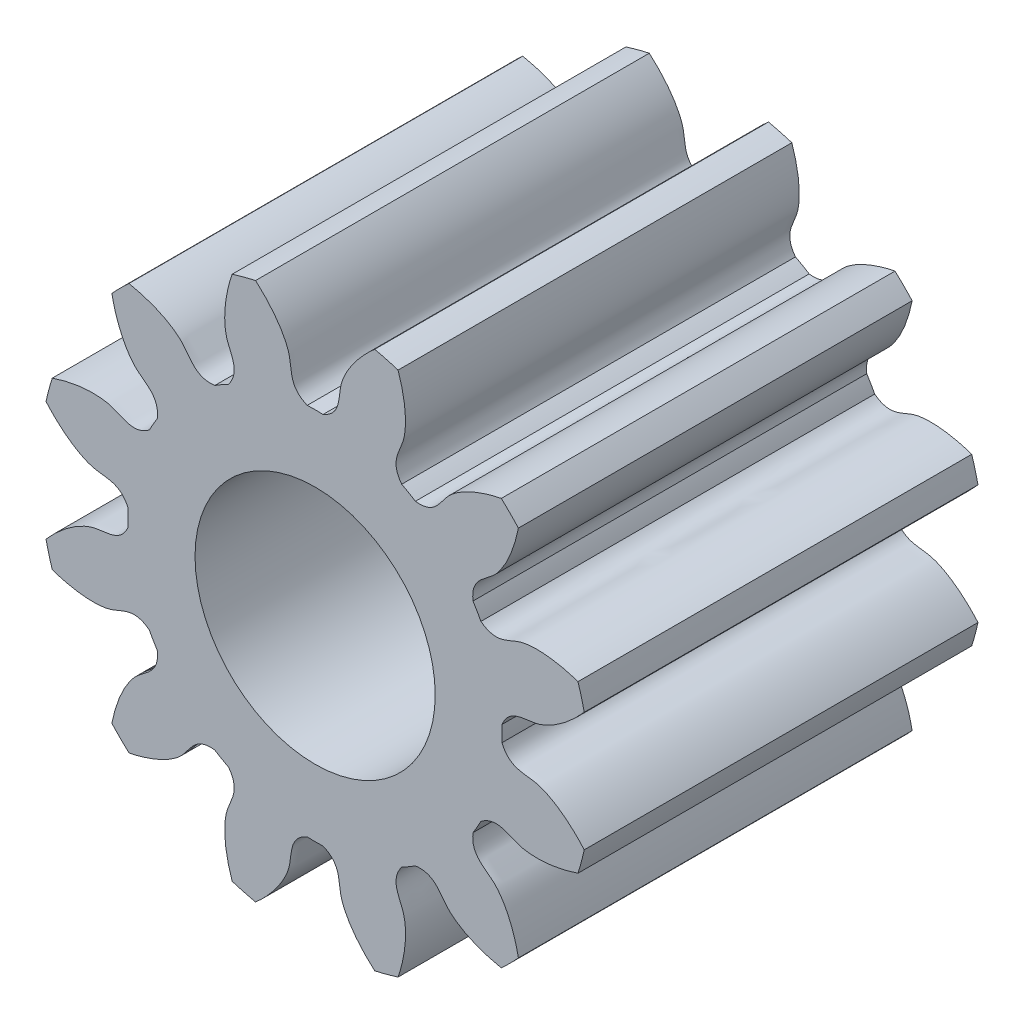
from build123d import *

# Parameters (mm, degrees)
SKETCH_1_R               = 3.5
EXTRUDE_1_DEPTH          = 5
CUT_EXTRUDE_1_DEPTH      = 8.03562364
PATTERN_CIRCULAR_1_COUNT = 12
CUT_EXTRUDE_2_REACH      = 8.954
SKETCH_4_R               = 1.525


with BuildPart() as part:
    # 草图1 → 凸台-拉伸1 (new body)
    with BuildSketch(Plane.XY):
        Circle(SKETCH_1_R)
    extrude(amount=EXTRUDE_1_DEPTH)

    # 草图2 → 切除-拉伸1 (cut, through all)
    with BuildSketch(Plane.XY):
        with BuildLine():
            ThreePointArc((0.100420056, 2.372876063), (0, 2.375), (-0.100420056, 2.372876063))
            add(Edge.make_bspline(
                [(-0.100420056, 2.372876063), (-0.340394435, 2.474653731), (-0.287186739, 2.672409341), (-0.338076094, 2.844740289), (-0.341311927, 2.854952869), (-0.345113625, 2.866166713), (-0.349521434, 2.878363044), (-0.354576313, 2.891521619), (-0.360318258, 2.905621034), (-0.36678678, 2.920638648), (-0.374020716, 2.936550626), (-0.382058239, 2.95333195), (-0.390936819, 2.970956436), (-0.400693193, 2.989396753), (-0.411363332, 3.008624444), (-0.422982412, 3.02860994), (-0.435584786, 3.049322589), (-0.449203949, 3.07073067), (-0.463872517, 3.092801417), (-0.479622192, 3.115501045), (-0.496483738, 3.138794769), (-0.514486952, 3.162646832), (-0.533660639, 3.187020528), (-0.554032585, 3.211878226), (-0.575629533, 3.237181399), (-0.598477155, 3.262890651), (-0.622600033, 3.288965742), (-0.648021632, 3.315365616), (-0.674764279, 3.342048434), (-0.702849139, 3.368971597), (-0.732296196, 3.396091781), (-0.763124233, 3.423364967), (-0.795350811, 3.450746465), (-0.828992247, 3.478190957), (-0.864063604, 3.505652518), (-0.900578664, 3.533084654), (-0.938549918, 3.560440334), (-0.977988547, 3.587672024), (-1.01890441, 3.614731718), (-1.061306025, 3.641570973), (-1.10520056, 3.668140947), (-1.150593819, 3.694392428), (-1.197490231, 3.720275872), (-1.245892835, 3.74574144), (-1.295803277, 3.770739031), (-1.347221796, 3.79521832), (-1.400147219, 3.819128792), (-1.454576948, 3.842419781), (-1.510506963, 3.865040505), (-1.567931802, 3.886940103), (-1.647189853, 3.915363979), (-1.7077968, 3.935050704), (-1.748802701, 3.947485455)],
                knots=[0, 0, 0, 0, 0.218015236, 0.222043642, 0.226545979, 0.231522246, 0.236972443, 0.24289657, 0.249294627, 0.256166614, 0.263512532, 0.271332379, 0.279626157, 0.288393865, 0.297635503, 0.307351072, 0.31754057, 0.328203999, 0.339341357, 0.350952646, 0.363037866, 0.375597015, 0.388630094, 0.402137104, 0.416118043, 0.430572913, 0.445501713, 0.460904444, 0.476781104, 0.493131694, 0.509956215, 0.527254666, 0.545027047, 0.563273358, 0.581993599, 0.601187771, 0.620855872, 0.640997904, 0.661613866, 0.682703758, 0.704267581, 0.726305333, 0.748817015, 0.771802628, 0.795262171, 0.819195644, 0.843603047, 0.868484381, 0.893839644, 0.919668838, 0.945971962, 1, 1, 1, 1], degree=3))
            ThreePointArc((-1.748802701, 3.947485455), (0, 4.317516914), (1.748802701, 3.947485455))
            add(Edge.make_bspline(
                [(0.100420056, 2.372876063), (0.340394435, 2.474653731), (0.287186739, 2.672409341), (0.338076094, 2.844740289), (0.341311927, 2.854952869), (0.345113625, 2.866166713), (0.349521434, 2.878363044), (0.354576313, 2.891521619), (0.360318258, 2.905621034), (0.36678678, 2.920638648), (0.374020716, 2.936550626), (0.382058239, 2.95333195), (0.390936819, 2.970956436), (0.400693193, 2.989396753), (0.411363332, 3.008624444), (0.422982412, 3.02860994), (0.435584786, 3.049322589), (0.449203949, 3.07073067), (0.463872517, 3.092801417), (0.479622192, 3.115501045), (0.496483738, 3.138794769), (0.514486952, 3.162646832), (0.533660639, 3.187020528), (0.554032585, 3.211878226), (0.575629533, 3.237181399), (0.598477155, 3.262890651), (0.622600033, 3.288965742), (0.648021632, 3.315365616), (0.674764279, 3.342048434), (0.702849139, 3.368971597), (0.732296196, 3.396091781), (0.763124233, 3.423364967), (0.795350811, 3.450746465), (0.828992247, 3.478190957), (0.864063604, 3.505652518), (0.900578664, 3.533084654), (0.938549918, 3.560440334), (0.977988547, 3.587672024), (1.01890441, 3.614731718), (1.061306025, 3.641570973), (1.10520056, 3.668140947), (1.150593819, 3.694392428), (1.197490231, 3.720275872), (1.245892835, 3.74574144), (1.295803277, 3.770739031), (1.347221796, 3.79521832), (1.400147219, 3.819128792), (1.454576948, 3.842419781), (1.510506963, 3.865040505), (1.567931802, 3.886940103), (1.647189853, 3.915363979), (1.7077968, 3.935050704), (1.748802701, 3.947485455)],
                knots=[0, 0, 0, 0, 0.218015236, 0.222043642, 0.226545979, 0.231522246, 0.236972443, 0.24289657, 0.249294627, 0.256166614, 0.263512532, 0.271332379, 0.279626157, 0.288393865, 0.297635503, 0.307351072, 0.31754057, 0.328203999, 0.339341357, 0.350952646, 0.363037866, 0.375597015, 0.388630094, 0.402137104, 0.416118043, 0.430572913, 0.445501713, 0.460904444, 0.476781104, 0.493131694, 0.509956215, 0.527254666, 0.545027047, 0.563273358, 0.581993599, 0.601187771, 0.620855872, 0.640997904, 0.661613866, 0.682703758, 0.704267581, 0.726305333, 0.748817015, 0.771802628, 0.795262171, 0.819195644, 0.843603047, 0.868484381, 0.893839644, 0.919668838, 0.945971962, 1, 1, 1, 1], degree=3))
        make_face()
    cut_extrude_1 = extrude(amount=CUT_EXTRUDE_1_DEPTH, mode=Mode.SUBTRACT)

    # 阵列(圆周)1: 切除-拉伸1 ×12 about axis
    pattern_circular_1_axis = Axis((0, 0, 5), (0, 0, -1))
    for i in range(1, PATTERN_CIRCULAR_1_COUNT):
        add(cut_extrude_1.rotate(pattern_circular_1_axis, i * 360 / PATTERN_CIRCULAR_1_COUNT), mode=Mode.SUBTRACT)

    # 草图4 → 切除-拉伸2 (cut, up to next)
    with BuildSketch(Plane(origin=(0, 0, 0), x_dir=(-1, 0, 0), z_dir=(0, 0, -1)), mode=Mode.PRIVATE) as cut_extrude_2_sk1:
        Circle(SKETCH_4_R)
    cut_extrude_2_tool1 = extrude(cut_extrude_2_sk1.sketch, amount=-CUT_EXTRUDE_2_REACH, mode=Mode.PRIVATE) & part.part
    add(cut_extrude_2_tool1.solids().sort_by_distance((0, 0, 0))[0], mode=Mode.SUBTRACT)


solid = part.part
